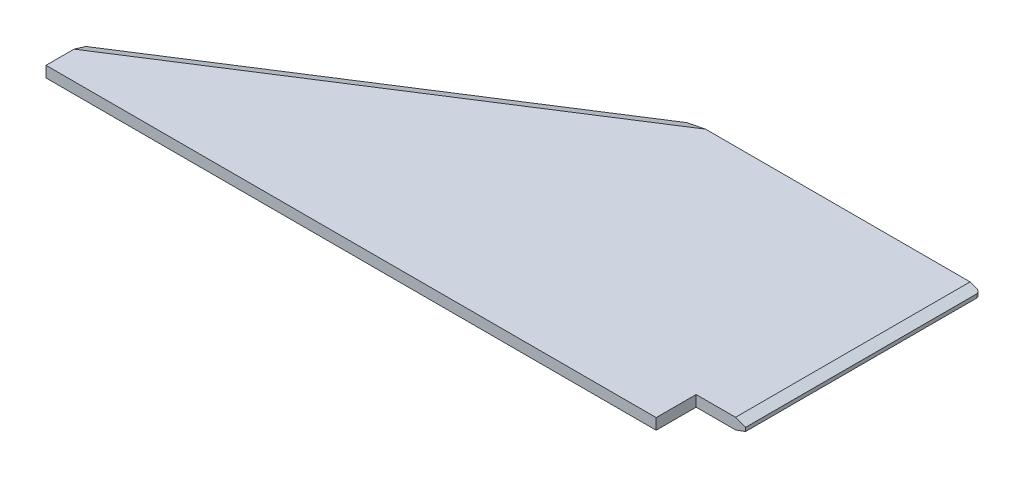
from build123d import *
from OCP.BRepFilletAPI import BRepFilletAPI_MakeChamfer

# Parameters (mm, degrees)
BOSS_EXTRUDE1_DEPTH = 3
CHAMFER1_SIZE       = 1
CHAMFER1_SIZE2      = 2.747477419
CHAMFER2_SIZE       = 1
CHAMFER2_SIZE2      = 2.747477419
FILLET1_R           = 1


with BuildPart() as part:
    # Sketch1 → Boss-Extrude1 (new body)
    with BuildSketch(Plane(origin=(0, 0, 0), x_dir=(1, 0, 0), z_dir=(0, 1, 0))):
        Polygon((0, 0), (0, 10.9), (100, 74.9), (180, 74.9), (180, 10.9), (166.5, 10.9), (166.5, 0), align=None)
    extrude(amount=BOSS_EXTRUDE1_DEPTH)

    # Chamfer1: one chamfer whose edges measure the first distance from different faces: ONE call of the kernel's chamfer builder (chamfer() names one face for all edges)
    chamfer1_edges_1 = [part.edges().sort_by_distance(p)[0] for p in [
        (180, 3, -42.9),
    ]]
    chamfer1_side_1 = [part.faces().sort_by_distance(p)[0] for p in [
        (180, 1.5, -42.9),
    ]]
    chamfer1_edges_2 = [part.edges().sort_by_distance(p)[0] for p in [
        (50, 3, -42.9),
    ]]
    chamfer1_side_2 = [part.faces().sort_by_distance(p)[0] for p in [
        (50, 1.5, -42.9),
    ]]
    chamfer1 = BRepFilletAPI_MakeChamfer(part.part.solid().wrapped)
    for e in chamfer1_edges_1:
        chamfer1.Add(CHAMFER1_SIZE, CHAMFER1_SIZE2, e.wrapped, chamfer1_side_1[0].wrapped)  # the first distance lies on this face
    for e in chamfer1_edges_2:
        chamfer1.Add(CHAMFER1_SIZE, CHAMFER1_SIZE2, e.wrapped, chamfer1_side_2[0].wrapped)  # the first distance lies on this face
    add(Compound.cast(chamfer1.Shape()), mode=Mode.REPLACE)

    # Chamfer2: one chamfer whose edges measure the first distance from different faces: ONE call of the kernel's chamfer builder (chamfer() names one face for all edges)
    chamfer2_edges_1 = [part.edges().sort_by_distance(p)[0] for p in [
        (50, 0, -42.9),
    ]]
    chamfer2_side_1 = [part.faces().sort_by_distance(p)[0] for p in [
        (50, 1, -42.9),
    ]]
    chamfer2_edges_2 = [part.edges().sort_by_distance(p)[0] for p in [
        (180, 0, -42.9),
    ]]
    chamfer2_side_2 = [part.faces().sort_by_distance(p)[0] for p in [
        (180, 1, -42.9),
    ]]
    chamfer2 = BRepFilletAPI_MakeChamfer(part.part.solid().wrapped)
    for e in chamfer2_edges_1:
        chamfer2.Add(CHAMFER2_SIZE, CHAMFER2_SIZE2, e.wrapped, chamfer2_side_1[0].wrapped)  # the first distance lies on this face
    for e in chamfer2_edges_2:
        chamfer2.Add(CHAMFER2_SIZE, CHAMFER2_SIZE2, e.wrapped, chamfer2_side_2[0].wrapped)  # the first distance lies on this face
    add(Compound.cast(chamfer2.Shape()), mode=Mode.REPLACE)

    # Fillet1
    fillet1_edges = [part.edges().sort_by_distance(p)[0] for p in [
        (180, 1.5, -74.9),
    ]]
    fillet(fillet1_edges, radius=FILLET1_R)


solid = part.part
